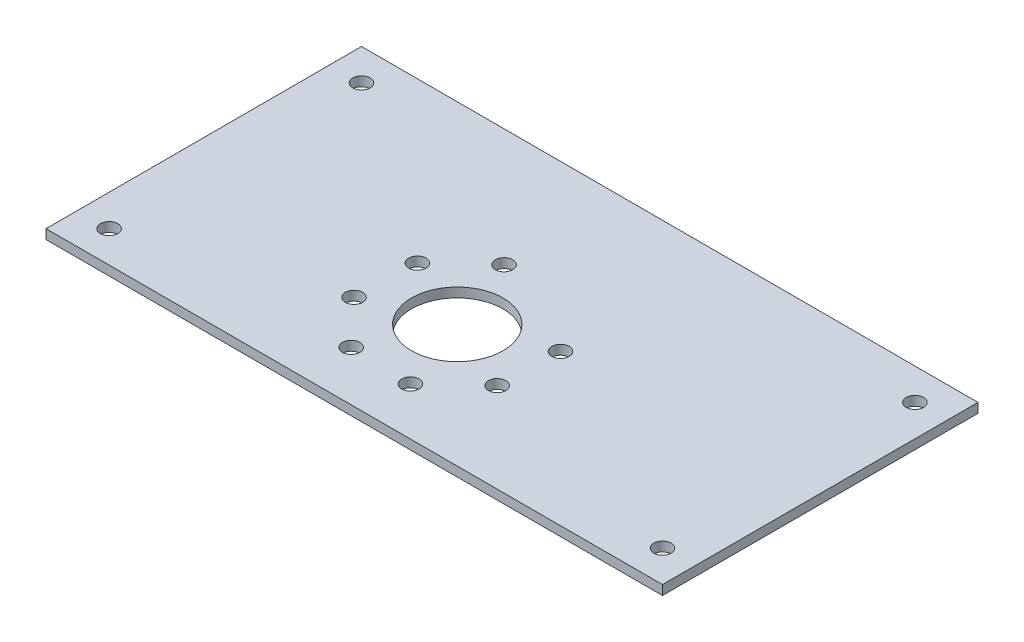
from build123d import *

# Parameters (mm, degrees)
SKETCH1_W           = 195.38
SKETCH1_H           = 100
BOSS_EXTRUDE1_DEPTH = 3
SKETCH2_R           = 2.75
CUT_EXTRUDE1_DEPTH  = 220.504770791
SKETCH3_R           = 2.75
SKETCH3_R_2         = 14.5
CUT_EXTRUDE2_DEPTH  = 220.504770791


with BuildPart() as part:
    # Sketch1 → Boss-Extrude1 (new body)
    with BuildSketch(Plane(origin=(0, 0, 0), x_dir=(1, 0, 0), z_dir=(0, 1, 0))):
        with Locations((97.69, -50)):
            Rectangle(SKETCH1_W, SKETCH1_H)
    extrude(amount=BOSS_EXTRUDE1_DEPTH)

    # Sketch2 → Cut-Extrude1 (cut, through all)
    with BuildSketch(Plane(origin=(0, 3, 0), x_dir=(1, 0, 0), z_dir=(0, 1, 0))):
        with Locations((185.38, -10)):
            Circle(SKETCH2_R)
        with Locations((185.38, -90)):
            Circle(SKETCH2_R)
        with Locations((9.987968139, -90)):
            Circle(SKETCH2_R)
        with Locations((9.987968139, -10)):
            Circle(SKETCH2_R)
    extrude(amount=-CUT_EXTRUDE1_DEPTH, mode=Mode.SUBTRACT)

    # Sketch3 → Cut-Extrude2 (cut, through all)
    with BuildSketch(Plane(origin=(0, 3, 0), x_dir=(1, 0, 0), z_dir=(0, 1, 0))):
        with Locations((82.494380009, -37.319881642)):
            Circle(SKETCH3_R)
        with Locations((68.301944797, -50.605240532)):
            Circle(SKETCH3_R)
        with Locations((67.660544978, -70.034975074)):
            Circle(SKETCH3_R)
        with Locations((115.209473441, -52.153716673)):
            Circle(SKETCH3_R)
        with Locations((114.568073623, -71.583451215)):
            Circle(SKETCH3_R)
        with Locations((100.375638411, -84.868810105)):
            Circle(SKETCH3_R)
        with Locations((80.945903869, -84.227410287)):
            Circle(SKETCH3_R)
        with Locations((91.43500921, -61.094345874)):
            Circle(SKETCH3_R_2)
    extrude(amount=-CUT_EXTRUDE2_DEPTH, mode=Mode.SUBTRACT)


solid = part.part
